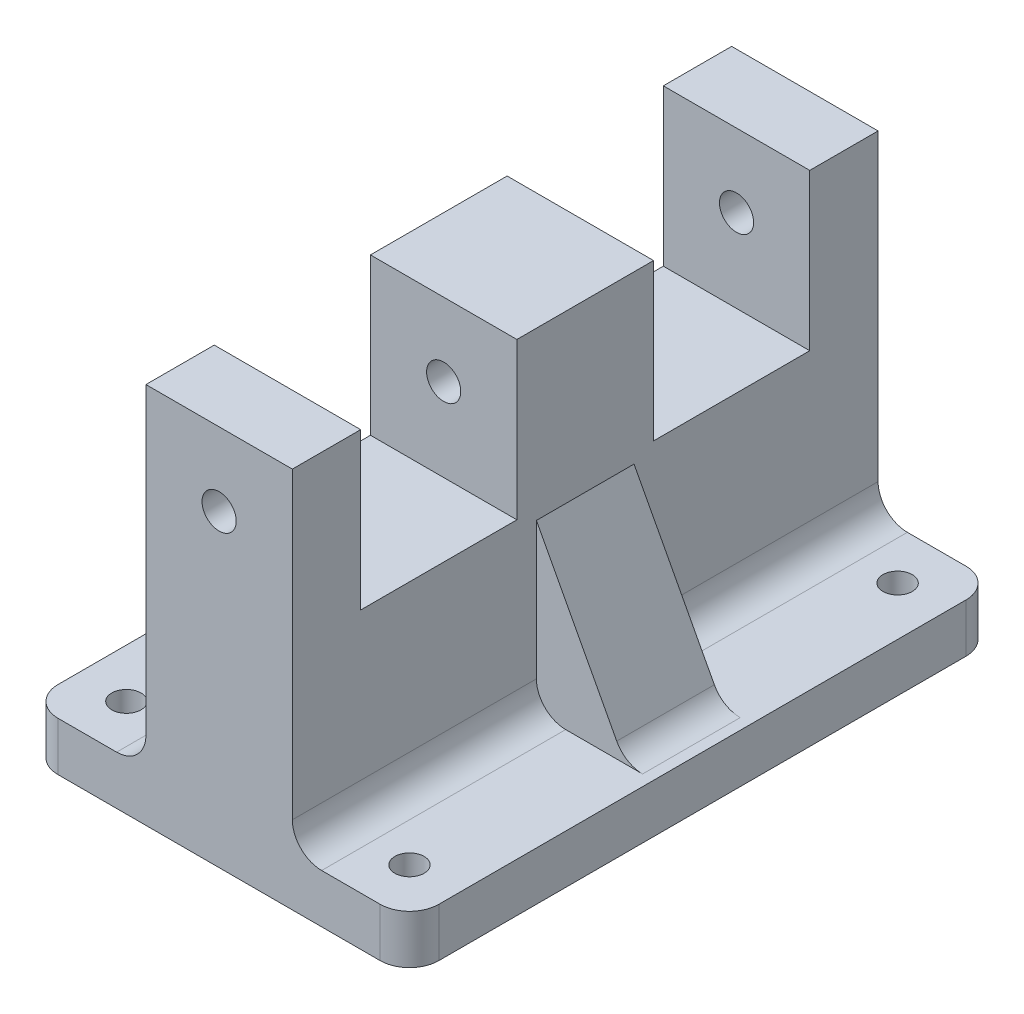
from build123d import *

# Parameters (mm, degrees)
SKETCH1_W                = 15
SKETCH1_H                = 60
BOSS_EXTRUDE2_DEPTH      = 39.11
BOSS_EXTRUDE3_DEPTH      = 12
BOSS_EXTRUDE3_DEPTH_BACK = 27
SKETCH3_W                = 60
SKETCH3_H                = 5
RIB1_REACH               = 55.008
SKETCH5_WALL_W           = 127.334599132
SKETCH5_WALL_H           = 10
SKETCH6_R                = 1.5
CUT_EXTRUDE2_DEPTH       = 50.434219929
SKETCH7_W                = 16
SKETCH7_H                = 16
CUT_EXTRUDE3_DEPTH       = 57.201353187
SKETCH8_R                = 1.75
CUT_EXTRUDE4_DEPTH       = 75.228310637
FILLET1_R                = 3


with BuildPart() as part:
    # Sketch1 → Boss-Extrude2 (new body)
    with BuildSketch(Plane(origin=(0, 0, 0), x_dir=(1, 0, 0), z_dir=(0, 1, 0))):
        Rectangle(SKETCH1_W, SKETCH1_H)
    extrude(amount=BOSS_EXTRUDE2_DEPTH)

    # Sketch3 → Boss-Extrude3 (add, two sides: drawn at the far end of the back side and taken through both)
    with BuildSketch(Plane.ZY.offset(7.5).offset(-BOSS_EXTRUDE3_DEPTH_BACK)):
        with Locations((0, 2.5)):
            Rectangle(SKETCH3_W, SKETCH3_H)
    extrude(amount=BOSS_EXTRUDE3_DEPTH + BOSS_EXTRUDE3_DEPTH_BACK)

    # Sketch5 wall → Rib1 (add, up to next)
    with BuildSketch(Plane(origin=(-12.037058369, 13.5275, 0), x_dir=(-0.46970610176, -0.882822846311, 0), z_dir=(0.882822846311, -0.46970610176, 0)), mode=Mode.PRIVATE) as rib1_sk1:
        Rectangle(SKETCH5_WALL_W, SKETCH5_WALL_H)
    rib1_tool1 = extrude(rib1_sk1.sketch, amount=RIB1_REACH, mode=Mode.PRIVATE) - part.part
    rib1 = rib1_tool1.solids().sort_by_distance((-12.037058369, 13.5275, 0))[0]
    add(rib1)

    # Sketch6 → Cut-Extrude2 (cut, through all)
    with BuildSketch(Plane(origin=(0, 5, 0), x_dir=(1, 0, 0), z_dir=(0, 1, 0))):
        with Locations((-14.5, -25)):
            Circle(SKETCH6_R)
        with Locations((-14.5, 25)):
            Circle(SKETCH6_R)
    cut_extrude2 = extrude(amount=-CUT_EXTRUDE2_DEPTH, mode=Mode.SUBTRACT)

    # Mirror1: Rib1, Cut-Extrude2 across plane
    add(rib1.mirror(Plane(origin=(0, 0, 0), x_dir=(0, 0, 1), z_dir=(1, 0, 0))))
    add(cut_extrude2.mirror(Plane(origin=(0, 0, 0), x_dir=(0, 0, 1), z_dir=(1, 0, 0))), mode=Mode.SUBTRACT)

    # Sketch7 → Cut-Extrude3 (cut, through all)
    with BuildSketch(Plane.ZY.offset(7.5)):
        with Locations((15, 31.11)):
            Rectangle(SKETCH7_W, SKETCH7_H)
    cut_extrude3 = extrude(amount=-CUT_EXTRUDE3_DEPTH, mode=Mode.SUBTRACT)

    # Mirror2: Cut-Extrude3 across plane
    add(cut_extrude3.mirror(Plane.XY), mode=Mode.SUBTRACT)

    # Sketch8 → Cut-Extrude4 (cut, through all)
    with BuildSketch(Plane(origin=(0, 0, -30), x_dir=(-1, 0, 0), z_dir=(0, 0, -1))):
        with Locations((0, 31.61)):
            Circle(SKETCH8_R)
    extrude(amount=-CUT_EXTRUDE4_DEPTH, mode=Mode.SUBTRACT)

    # Fillet1
    fillet1_edges = [part.edges().sort_by_distance(p)[0] for p in [
        (-16.574116738, 5, 0),
        (-7.5, 5, -17.5),
        (-7.5, 5, 17.5),
        (16.574116738, 5, 0),
        (7.5, 5, 17.5),
        (7.5, 5, -17.5),
    ]]
    fillet(fillet1_edges, radius=FILLET1_R)
    fillet1_2_edges = [part.edges().sort_by_distance(p)[0] for p in [
        (19.5, 2.5, -30),
        (19.5, 2.5, 30),
        (-19.5, 2.5, 30),
        (-19.5, 2.5, -30),
    ]]
    fillet(fillet1_2_edges, radius=FILLET1_R)


solid = part.part
